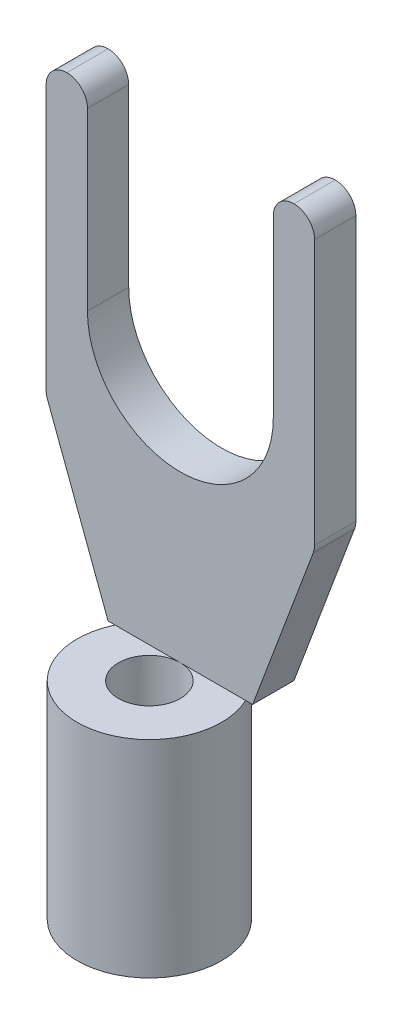
from build123d import *

# Parameters (mm, degrees)
AUFSATZ_LINEAR_AUSTRAGEN1_DEPTH = 1
VERRUNDUNG1_R                   = 0.5
SKIZZE2_R                       = 1.75
SKIZZE2_R_2                     = 0.75
AUFSATZ_LINEAR_AUSTRAGEN2_DEPTH = 5


with BuildPart() as part:
    # Skizze1 → Aufsatz-Linear austragen1 (new body)
    with BuildSketch(Plane.XY):
        with BuildLine():
            Line((-3.25, 9), (-3.25, 2))
            Line((-3.25, 2), (-1.75, -2))
            Line((-1.75, -2), (1.75, -2))
            Line((1.75, -2), (3.25, 2))
            Line((3.25, 2), (3.25, 9))
            Line((3.25, 9), (2.25, 9))
            Line((2.25, 9), (2.25, 4.25))
            ThreePointArc((2.25, 4.25), (0, 2), (-2.25, 4.25))
            Line((-2.25, 4.25), (-2.25, 9))
            Line((-2.25, 9), (-3.25, 9))
        make_face()
    extrude(amount=AUFSATZ_LINEAR_AUSTRAGEN1_DEPTH)

    # Verrundung1
    verrundung1_edges = [part.edges().sort_by_distance(p)[0] for p in [
        (-3.25, 2, 0.5),
        (3.25, 2, 0.5),
        (3.25, 9, 0.5),
        (2.25, 9, 0.5),
        (-2.25, 9, 0.5),
        (-3.25, 9, 0.5),
    ]]
    fillet(verrundung1_edges, radius=VERRUNDUNG1_R - 0.0001)  # a hair under: the kernel refuses the full size

    # Skizze2 → Aufsatz-Linear austragen2 (add)
    with BuildSketch(Plane.XZ.offset(2)):
        with Locations(Location((0, 1.75, 0), (0, 0, 205.376933525))):
            Circle(SKIZZE2_R)
        with Locations(Location((0, 1.75, 0), (0, 0, 270))):
            Circle(SKIZZE2_R_2, mode=Mode.SUBTRACT)
    extrude(amount=AUFSATZ_LINEAR_AUSTRAGEN2_DEPTH)


solid = part.part
